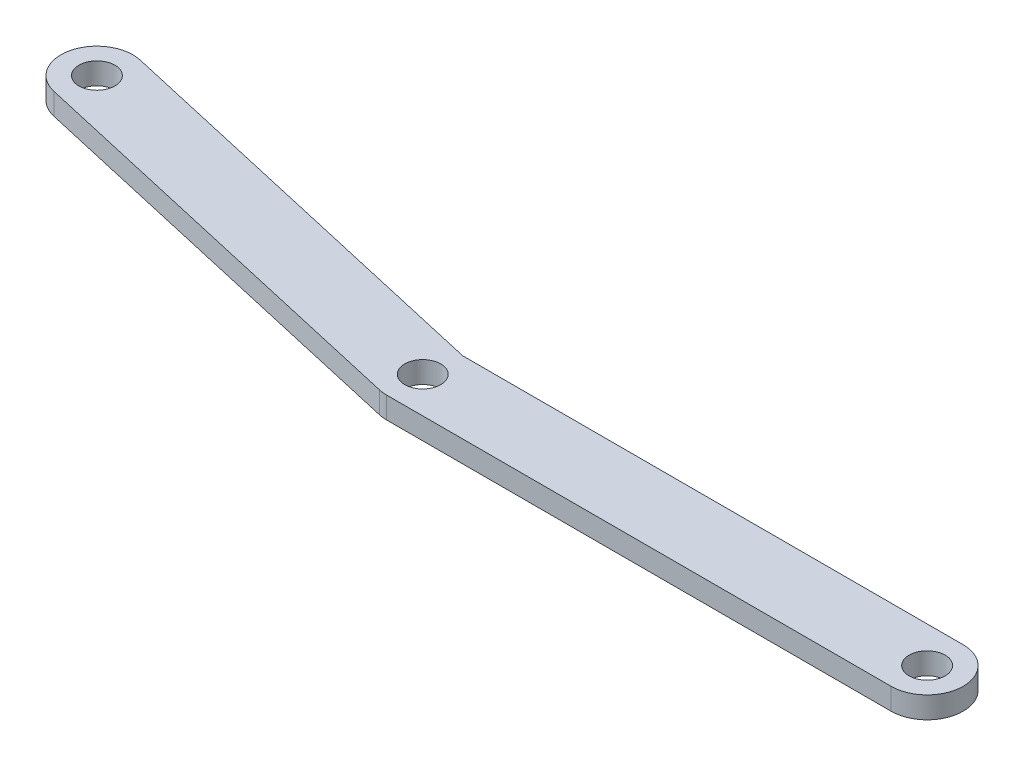
from build123d import *

# Parameters (mm, degrees)
SKETCH2_R               = 3.175
BOSS_EXTRUDE2_DEPTH     = 3.81
SKETCH1_R               = 3.175
BOSS_EXTRUDE3_DEPTH     = 3.81
CUT_EXTRUDE1_DEPTH      = 128.302192566
CUT_EXTRUDE1_DEPTH_BACK = 128.302192566
SKETCH3_R               = 3.175


with BuildPart() as part:
    # Sketch2 → Boss-Extrude2 (new body)
    with BuildSketch(Plane(origin=(0, 0, 0), x_dir=(1, 0, 0), z_dir=(0, 1, 0))):
        with BuildLine():
            Line((-120.163213758, 10.689797119), (-45.85683296, -6.1921984))
            ThreePointArc((-45.85683296, -6.1921984), (-38.2578016, -1.40683296), (-43.04316704, 6.1921984))
            Line((-43.04316704, 6.1921984), (-117.349547838, 23.074193918))
            ThreePointArc((-117.349547838, 23.074193918), (-124.948579198, 18.288828478), (-120.163213758, 10.689797119))
        make_face()
        with Locations((-118.756380798, 16.881995519)):
            Circle(SKETCH2_R, mode=Mode.SUBTRACT)
    extrude(amount=BOSS_EXTRUDE2_DEPTH)

    # Sketch1 → Boss-Extrude3 (add)
    with BuildSketch(Plane(origin=(0, 0, 0), x_dir=(1, 0, 0), z_dir=(0, 1, 0))):
        with BuildLine():
            Line((44.45, 6.35), (-44.45, 6.35))
            ThreePointArc((-44.45, 6.35), (-50.8, 0), (-44.45, -6.35))
            Line((-44.45, -6.35), (44.45, -6.35))
            ThreePointArc((44.45, -6.35), (50.8, 0), (44.45, 6.35))
        make_face()
        with Locations((44.45, 0)):
            Circle(SKETCH1_R, mode=Mode.SUBTRACT)
    extrude(amount=BOSS_EXTRUDE3_DEPTH)

    # Sketch3 → Cut-Extrude1 (cut, two sides: drawn at the far end of the back side and taken through both)
    with BuildSketch(Plane(origin=(0, 3.81, 0), x_dir=(1, 0, 0), z_dir=(0, 1, 0)).offset(-CUT_EXTRUDE1_DEPTH_BACK)):
        with Locations((-44.45, 0)):
            Circle(SKETCH3_R)
    extrude(amount=CUT_EXTRUDE1_DEPTH + CUT_EXTRUDE1_DEPTH_BACK, mode=Mode.SUBTRACT)


solid = part.part
